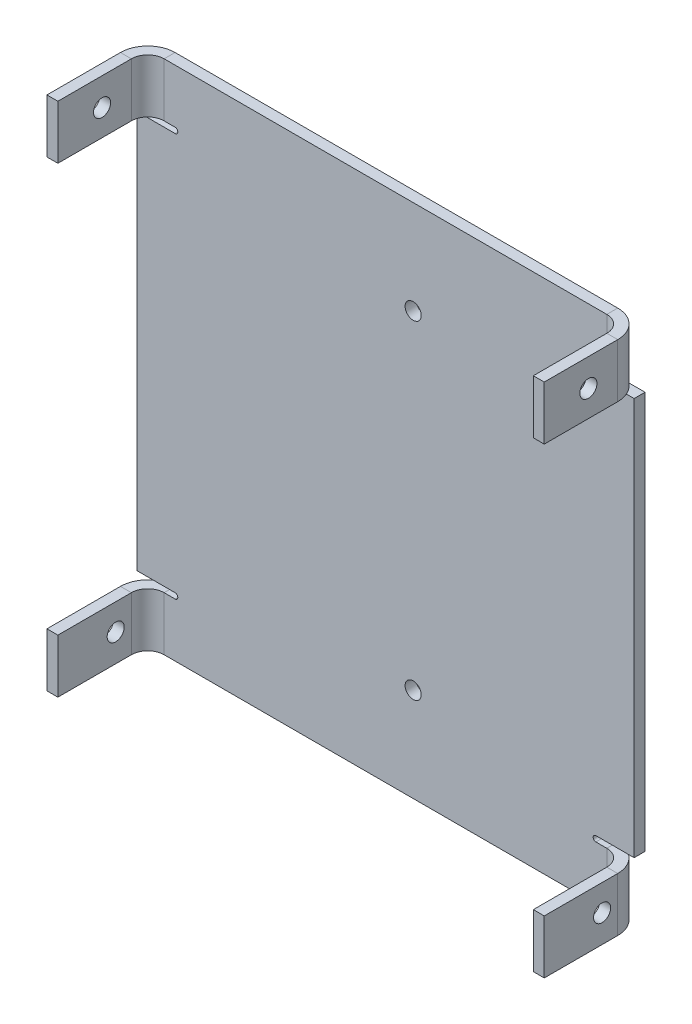
from build123d import *

# Parameters (mm, degrees)
BOSS_EXTRUDE1_DEPTH     = 48
BOSS_EXTRUDE2_START     = 48
BOSS_EXTRUDE2_DEPTH     = 10
BOSS_EXTRUDE3_START     = -48
BOSS_EXTRUDE3_DEPTH     = 10
CONVERT_SOLID1_START    = -48
CONVERT_SOLID1_DEPTH    = 10
CONVERT_SOLID1_START_2  = 38
CONVERT_SOLID1_2_DEPTH  = 10
CONVERT_SOLID1_3_DEPTH  = 2.032
CONVERT_SOLID1_4_DEPTH  = 11.016
CONVERT_SOLID1_START_3  = 36.984
CONVERT_SOLID1_5_DEPTH  = 11.016
CUT_EXTRUDE1_DEPTH      = 70.243230716
CUT_EXTRUDE1_DEPTH_BACK = 70.243230716
SKETCH6_R               = 1.59
SKETCH7_R               = 1.5
CUT_EXTRUDE3_DEPTH      = 2.032


# Read off the part's stored shape, not the designer's step: Convert-Solid1
with BuildPart() as part:
    # Sketch1 → Boss-Extrude1 (new, symmetric)
    with BuildSketch(Plane(origin=(0, 0, 0), x_dir=(1, 0, 0), z_dir=(0, 1, 0))):
        Polygon((-44.218, 0), (-46.25, 0), (-46.25, -2.032), (-44.218, -2.032), (44.218, -2.032), (46.25, -2.032), (46.25, 0), (44.218, 0), align=None)
    extrude(amount=BOSS_EXTRUDE1_DEPTH, both=True)

    # Sketch1<3> → Boss-Extrude2 (add)
    with BuildSketch(Plane(origin=(0, 0, 0), x_dir=(1, 0, 0), z_dir=(0, 1, 0)).offset(BOSS_EXTRUDE2_START)):
        Polygon((-46.25, 0), (46.25, 0), (46.25, -18.75), (44.218, -18.75), (44.218, -2.032), (-44.218, -2.032), (-44.218, -18.75), (-46.25, -18.75), align=None)
    extrude(amount=-BOSS_EXTRUDE2_DEPTH)

    # Sketch1<4> → Boss-Extrude3 (add)
    with BuildSketch(Plane(origin=(0, 0, 0), x_dir=(1, 0, 0), z_dir=(0, 1, 0)).offset(BOSS_EXTRUDE3_START)):
        Polygon((-46.25, 0), (46.25, 0), (46.25, -18.75), (44.218, -18.75), (44.218, -2.032), (-44.218, -2.032), (-44.218, -18.75), (-46.25, -18.75), align=None)
    extrude(amount=BOSS_EXTRUDE3_DEPTH)

    # Convert-Solid1 outline → Convert-Solid1 (add)
    with BuildSketch(Plane(origin=(0, 0, 0), x_dir=(1, 0, 0), z_dir=(0, 1, 0)).offset(CONVERT_SOLID1_START)):
        with BuildLine():
            ThreePointArc((41.17, -2.032), (43.325261469, -2.924738531), (44.218, -5.08))
            Line((44.218, -5.08), (44.218, -2.032))
            Line((44.218, -2.032), (41.17, -2.032))
        make_face()
        with BuildLine():
            ThreePointArc((-44.218, -5.08), (-43.325261469, -2.924738531), (-41.17, -2.032))
            Line((-41.17, -2.032), (-44.218, -2.032))
            Line((-44.218, -2.032), (-44.218, -5.08))
        make_face()
    extrude(amount=CONVERT_SOLID1_DEPTH)

    # Convert-Solid1 2 outline → Convert-Solid1 2 (add)
    with BuildSketch(Plane(origin=(0, 0, 0), x_dir=(1, 0, 0), z_dir=(0, 1, 0)).offset(CONVERT_SOLID1_START_2)):
        with BuildLine():
            ThreePointArc((41.17, -2.032), (43.325261469, -2.924738531), (44.218, -5.08))
            Line((44.218, -5.08), (44.218, -2.032))
            Line((44.218, -2.032), (41.17, -2.032))
        make_face()
        with BuildLine():
            ThreePointArc((-44.218, -5.08), (-43.325261469, -2.924738531), (-41.17, -2.032))
            Line((-41.17, -2.032), (-44.218, -2.032))
            Line((-44.218, -2.032), (-44.218, -5.08))
        make_face()
    extrude(amount=CONVERT_SOLID1_2_DEPTH)

    # Convert-Solid1 3 outline → Convert-Solid1 3 (cut)
    with BuildSketch(Plane.XY):
        with BuildLine():
            ThreePointArc((39.138, -36.984), (38.63, -37.492), (39.138, -38))
            Line((39.138, -38), (46.25, -38))
            Line((46.25, -38), (46.25, -36.984))
            Line((46.25, -36.984), (39.138, -36.984))
        make_face()
        with BuildLine():
            Line((39.138, 36.984), (46.25, 36.984))
            Line((46.25, 36.984), (46.25, 38))
            Line((46.25, 38), (39.138, 38))
            ThreePointArc((39.138, 38), (38.63, 37.492), (39.138, 36.984))
        make_face()
        with BuildLine():
            Line((-46.25, -36.984), (-46.25, -38))
            Line((-46.25, -38), (-39.138, -38))
            ThreePointArc((-39.138, -38), (-38.63, -37.492), (-39.138, -36.984))
            Line((-39.138, -36.984), (-46.25, -36.984))
        make_face()
        with BuildLine():
            Line((-39.138, 38), (-46.25, 38))
            Line((-46.25, 38), (-46.25, 36.984))
            Line((-46.25, 36.984), (-39.138, 36.984))
            ThreePointArc((-39.138, 36.984), (-38.63, 37.492), (-39.138, 38))
        make_face()
    extrude(amount=CONVERT_SOLID1_3_DEPTH, mode=Mode.SUBTRACT)

    # Convert-Solid1 4 outline → Convert-Solid1 4 (cut)
    with BuildSketch(Plane(origin=(0, 0, 0), x_dir=(1, 0, 0), z_dir=(0, 1, 0)).offset(CONVERT_SOLID1_START)):
        with BuildLine():
            Line((46.25, -5.08), (46.25, 0))
            Line((46.25, 0), (41.17, 0))
            ThreePointArc((41.17, 0), (44.762102448, -1.487897552), (46.25, -5.08))
        make_face()
        with BuildLine():
            Line((-46.25, 0), (-46.25, -5.08))
            ThreePointArc((-46.25, -5.08), (-44.762102448, -1.487897552), (-41.17, 0))
            Line((-41.17, 0), (-46.25, 0))
        make_face()
    extrude(amount=CONVERT_SOLID1_4_DEPTH, mode=Mode.SUBTRACT)

    # Convert-Solid1 5 outline → Convert-Solid1 5 (cut)
    with BuildSketch(Plane(origin=(0, 0, 0), x_dir=(1, 0, 0), z_dir=(0, 1, 0)).offset(CONVERT_SOLID1_START_3)):
        with BuildLine():
            Line((46.25, -5.08), (46.25, 0))
            Line((46.25, 0), (41.17, 0))
            ThreePointArc((41.17, 0), (44.762102448, -1.487897552), (46.25, -5.08))
        make_face()
        with BuildLine():
            Line((-46.25, 0), (-46.25, -5.08))
            ThreePointArc((-46.25, -5.08), (-44.762102448, -1.487897552), (-41.17, 0))
            Line((-41.17, 0), (-46.25, 0))
        make_face()
    extrude(amount=CONVERT_SOLID1_5_DEPTH, mode=Mode.SUBTRACT)

    # Sketch6 → Cut-Extrude1 (cut, two sides: drawn at the far end of the back side and taken through both)
    with BuildSketch(Plane(origin=(0, 0, 0), x_dir=(0, 0, -1), z_dir=(1, 0, 0)).offset(-CUT_EXTRUDE1_DEPTH_BACK)):
        with Locations((-10.535, 42.865)):
            Circle(SKETCH6_R)
        with Locations((-7.995, -42.865)):
            Circle(SKETCH6_R)
    extrude(amount=CUT_EXTRUDE1_DEPTH + CUT_EXTRUDE1_DEPTH_BACK, mode=Mode.SUBTRACT)

    # Sketch7 → Cut-Extrude3 (cut)
    with BuildSketch(Plane(origin=(0, 0, 0), x_dir=(-1, 0, 0), z_dir=(0, 0, -1))):
        with Locations((-5.148, 30.54163056)):
            Circle(SKETCH7_R)
        with Locations((-5.148, -30.54163056)):
            Circle(SKETCH7_R)
    extrude(amount=-CUT_EXTRUDE3_DEPTH, mode=Mode.SUBTRACT)


solid = part.part
